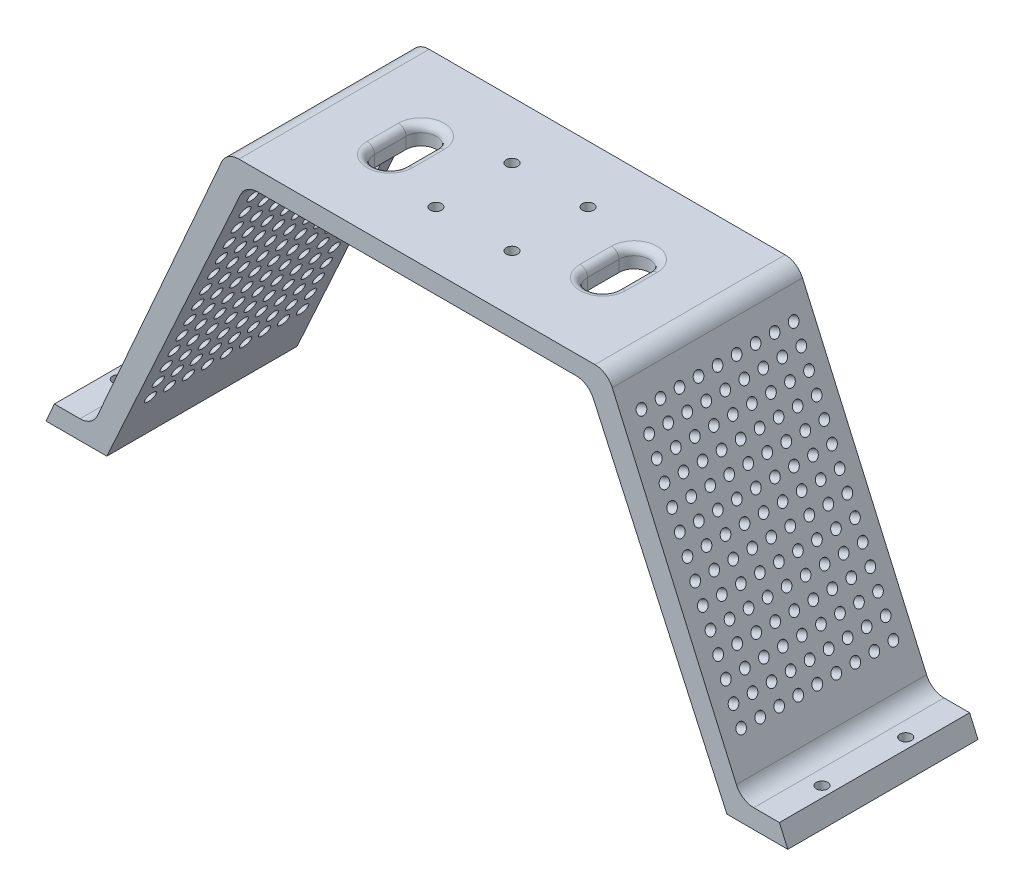
from build123d import *

# Parameters (mm, degrees)
BOSS_EXTRUDE2_DEPTH  = 50
CUT_EXTRUDE1_DEPTH   = 50
FILLET1_R            = 5
SKETCH10_W           = 50
SKETCH10_H           = 5.46
BOSS_EXTRUDE4_DEPTH  = 10
SKETCH5_W            = 50
SKETCH5_H            = 5.464
BOSS_EXTRUDE5_DEPTH  = 10
SKETCH11_R           = 1.5
CUT_EXTRUDE2_DEPTH   = 10
SKETCH12_R           = 1.5
CUT_EXTRUDE3_DEPTH   = 10
FILLET2_R            = 5
FILLET3_R            = 5
SKETCH13_R           = 1.5
CUT_EXTRUDE5_DEPTH   = 10
SKETCH14_R           = 3
CUT_EXTRUDE6_DEPTH   = 2.5
CUT_EXTRUDE8_DEPTH   = 8.5
FILLET5_R            = 2
SKETCH16_R           = 1.3
CUT_EXTRUDE9_DEPTH   = 12
LPATTERN1_COUNT      = 9
LPATTERN1_PITCH      = 5
LPATTERN1_COUNT_DIR2 = 14
LPATTERN1_PITCH_DIR2 = 5
SKETCH17_R           = 1.5
CUT_EXTRUDE10_DEPTH  = 12
LPATTERN2_COUNT      = 9
LPATTERN2_PITCH      = 5
LPATTERN2_COUNT_DIR2 = 14
LPATTERN2_PITCH_DIR2 = 5


with BuildPart() as part:
    # Sketch1 → Boss-Extrude2 (new body)
    with BuildSketch(Plane.XY):
        Polygon((-87.5, 0), (87.5, 0), (50.05, 85), (-50.05, 85), align=None)
    extrude(amount=BOSS_EXTRUDE2_DEPTH)

    # Sketch3 → Cut-Extrude1 (cut)
    with BuildSketch(Plane.XY.offset(50)):
        Polygon((-81.5, 0), (81.5, 0), (45.05, 80), (-45.05, 80), align=None)
    extrude(amount=-CUT_EXTRUDE1_DEPTH, mode=Mode.SUBTRACT)

    # Fillet1
    fillet1_edges = [part.edges().sort_by_distance(p)[0] for p in [
        (45.05, 80, 25),
        (-45.05, 80, 25),
    ]]
    fillet(fillet1_edges, radius=FILLET1_R)

    # Sketch10 → Boss-Extrude4 (add, along a direction that is not the sketch's normal)
    with BuildSketch(Plane(origin=(-73.275840836, 32.284473404, 0), x_dir=(0, 0, 1), z_dir=(-0.9151164849241618, 0.4031895571812924, 0))):
        with Locations((25, -32.549086253)):
            Rectangle(SKETCH10_W, SKETCH10_H)
    extrude(amount=BOSS_EXTRUDE4_DEPTH, dir=(-1, 0, 0))

    # Sketch5 → Boss-Extrude5 (add, along a direction that is not the sketch's normal)
    with BuildSketch(Plane(origin=(73.275840836, 32.284473404, 0), x_dir=(0, 0, -1), z_dir=(0.9151164849241616, 0.4031895571812925, 0))):
        with Locations((-25, -32.547086253)):
            Rectangle(SKETCH5_W, SKETCH5_H)
    extrude(amount=BOSS_EXTRUDE5_DEPTH, dir=(1, 0, 0))

    # Sketch11 → Cut-Extrude2 (cut)
    with BuildSketch(Plane(origin=(0, 4.996536008, 0), x_dir=(1, 0, 0), z_dir=(0, 1, 0))):
        with Locations((-92.5, -14)):
            Circle(SKETCH11_R)
        with Locations((-92.5, -36)):
            Circle(SKETCH11_R)
    extrude(amount=-CUT_EXTRUDE2_DEPTH, mode=Mode.SUBTRACT)

    # Sketch12 → Cut-Extrude3 (cut)
    with BuildSketch(Plane(origin=(0, 5.000196474, 0), x_dir=(1, 0, 0), z_dir=(0, 1, 0))):
        with Locations((92.5, -14)):
            Circle(SKETCH12_R)
        with Locations((92.5, -36)):
            Circle(SKETCH12_R)
    extrude(amount=-CUT_EXTRUDE3_DEPTH, mode=Mode.SUBTRACT)

    # Fillet2
    fillet2_edges = [part.edges().sort_by_distance(p)[0] for p in [
        (85.29697226, 5.000196474, 25),
        (-85.298585018, 4.996536008, 25),
    ]]
    fillet(fillet2_edges, radius=FILLET2_R)

    # Fillet3
    fillet3_edges = [part.edges().sort_by_distance(p)[0] for p in [
        (50.05, 85, 25),
        (-50.05, 85, 25),
    ]]
    fillet(fillet3_edges, radius=FILLET3_R)

    # Sketch13 → Cut-Extrude5 (cut)
    with BuildSketch(Plane(origin=(0, 85, 0), x_dir=(1, 0, 0), z_dir=(0, 1, 0))):
        with Locations((-9.999155874, -15)):
            Circle(SKETCH13_R)
        with Locations((10.000844126, -15)):
            Circle(SKETCH13_R)
        with Locations((-9.999155874, -35)):
            Circle(SKETCH13_R)
        with Locations((10.000844126, -35)):
            Circle(SKETCH13_R)
    extrude(amount=-CUT_EXTRUDE5_DEPTH, mode=Mode.SUBTRACT)

    # Sketch14 → Cut-Extrude6 (cut)
    with BuildSketch(Plane.XZ.offset(-80)):
        with Locations((-9.999155874, 35)):
            Circle(SKETCH14_R)
        with Locations((-9.999155874, 15)):
            Circle(SKETCH14_R)
        with Locations((10.000844126, 35)):
            Circle(SKETCH14_R)
        with Locations((10.000844126, 15)):
            Circle(SKETCH14_R)
    extrude(amount=-CUT_EXTRUDE6_DEPTH, mode=Mode.SUBTRACT)

    # Sketch15 → Cut-Extrude8 (cut)
    with BuildSketch(Plane(origin=(0, 85, 0), x_dir=(1, 0, 0), z_dir=(0, 1, 0))):
        with BuildLine():
            Line((-23.999155874, -20.87), (-23.999155874, -29.13))
            ThreePointArc((-23.999155874, -29.13), (-27.999155874, -33.13), (-31.999155874, -29.13))
            Line((-31.999155874, -29.13), (-31.999155874, -20.87))
            ThreePointArc((-31.999155874, -20.87), (-27.999155874, -16.87), (-23.999155874, -20.87))
        make_face()
        with BuildLine():
            Line((32.000844126, -20.87), (32.000844126, -29.13))
            ThreePointArc((32.000844126, -29.13), (28.000844126, -33.13), (24.000844126, -29.13))
            Line((24.000844126, -29.13), (24.000844126, -20.87))
            ThreePointArc((24.000844126, -20.87), (28.000844126, -16.87), (32.000844126, -20.87))
        make_face()
    extrude(amount=-CUT_EXTRUDE8_DEPTH, mode=Mode.SUBTRACT)

    # Fillet5
    fillet5_edges = [part.edges().sort_by_distance(p)[0] for p in [
        (-27.999155874, 85, 33.13),
        (-23.999155874, 85, 25),
        (-31.999155874, 85, 25),
        (-27.999155874, 85, 16.87),
        (28.000844126, 85, 16.87),
        (32.000844126, 85, 25),
        (24.000844126, 85, 25),
        (28.000844126, 85, 33.13),
    ]]
    fillet(fillet5_edges, radius=FILLET5_R)

    # Sketch16 → Cut-Extrude9 (cut)
    with BuildSketch(Plane(origin=(73.275840836, 32.284473404, 0), x_dir=(0, 0, -1), z_dir=(0.9151164849241616, 0.4031895571812925, 0))):
        with Locations((-45, 47.710567453)):
            Circle(SKETCH16_R)
    cut_extrude9 = extrude(amount=-CUT_EXTRUDE9_DEPTH, mode=Mode.SUBTRACT)

    # LPattern1: Cut-Extrude9 9 × 14
    with Locations(*[Vector(0, 0, -1) * (i * LPATTERN1_PITCH) + Vector(0.40318955718129246, -0.9151164849241616, 0) * (j * LPATTERN1_PITCH_DIR2) for i in range(LPATTERN1_COUNT) for j in range(LPATTERN1_COUNT_DIR2) if (i, j) != (0, 0)]):
        add(cut_extrude9, mode=Mode.SUBTRACT)

    # Sketch17 → Cut-Extrude10 (cut)
    with BuildSketch(Plane(origin=(-73.275840836, 32.284473404, 0), x_dir=(0, 0, 1), z_dir=(-0.9151164849241618, 0.4031895571812924, 0))):
        with Locations((5, 47.714419756)):
            Circle(SKETCH17_R)
    cut_extrude10 = extrude(amount=-CUT_EXTRUDE10_DEPTH, mode=Mode.SUBTRACT)

    # LPattern2: Cut-Extrude10 9 × 14
    with Locations(*[Vector(0, 0, 1) * (i * LPATTERN2_PITCH) + Vector(-0.40318955718129224, -0.9151164849241618, 0) * (j * LPATTERN2_PITCH_DIR2) for i in range(LPATTERN2_COUNT) for j in range(LPATTERN2_COUNT_DIR2) if (i, j) != (0, 0)]):
        add(cut_extrude10, mode=Mode.SUBTRACT)


solid = part.part
